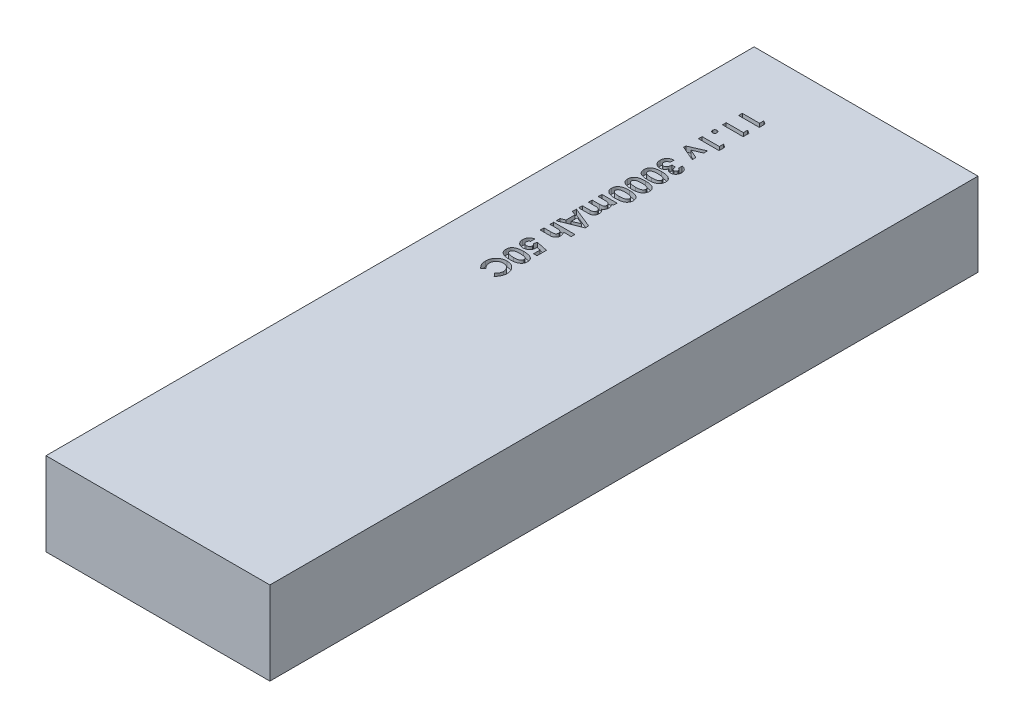
from build123d import *

# Parameters (mm, degrees)
SKETCH1_W           = 43
SKETCH1_H           = 136
BOSS_EXTRUDE1_DEPTH = 16
CUT_EXTRUDE3_DEPTH  = 1


with BuildPart() as part:
    # Sketch1 → Boss-Extrude1 (new body)
    with BuildSketch(Plane(origin=(0, 0, 0), x_dir=(1, 0, 0), z_dir=(0, 1, 0))):
        Rectangle(SKETCH1_W, SKETCH1_H)
    extrude(amount=BOSS_EXTRUDE1_DEPTH)

    # Sketch6 → Cut-Extrude3 (cut)
    # profile 1 of 15: a face of its own
    with BuildSketch(Plane(origin=(0, 16, 0), x_dir=(1, 0, 0), z_dir=(0, 1, 0))):
        Polygon((-7.606060002, 56.204884521), (-7.606060002, 55.103779002), (-11.574810002, 55.103779002), (-11.574810002, 55.816118746), (-8.267518335, 55.816118746), (-8.267518335, 56.63022131), align=None)
    # profile 2 of 15: a face of its own
    with BuildSketch(Plane(origin=(0, 16, 0), x_dir=(1, 0, 0), z_dir=(0, 1, 0))):
        Polygon((-7.606060002, 53.101118496), (-7.606060002, 52.000012977), (-11.574810002, 52.000012977), (-11.574810002, 52.71235272), (-8.267518335, 52.71235272), (-8.267518335, 53.526455285), align=None)
    # profile 3 of 15: a face of its own
    with BuildSketch(Plane(origin=(0, 16, 0), x_dir=(1, 0, 0), z_dir=(0, 1, 0))):
        with BuildLine():
            add(Edge.make_bspline(
                [(-10.760707437, 50.142841502), (-10.762271873, 50.114078339), (-10.765351977, 50.057448638), (-10.788757525, 49.97551841), (-10.829901512, 49.901145037), (-10.884528851, 49.83511534), (-10.949541031, 49.779050333), (-11.024498867, 49.739845227), (-11.105715388, 49.714485392), (-11.162530434, 49.711749694), (-11.191609381, 49.710349515)],
                knots=[0, 0, 0, 0, 1.016476041, 2.001265769, 2.982571086, 4.001334304, 5.018889842, 5.99575474, 6.974191785, 8, 8, 8, 8], degree=3))
            add(Edge.make_bspline(
                [(-11.191609381, 49.710349515), (-11.220692814, 49.711740517), (-11.277516627, 49.714458285), (-11.358895197, 49.740018581), (-11.434461218, 49.778987877), (-11.500174694, 49.835120021), (-11.555827131, 49.900870252), (-11.596582338, 49.975689104), (-11.621304585, 50.057292884), (-11.624215068, 50.114050943), (-11.625691412, 50.142841502)],
                knots=[0, 0, 0, 0, 1.022731703, 1.998234309, 2.980426153, 4.002090265, 5.023754376, 6.00211665, 6.986572482, 8, 8, 8, 8], degree=3))
            add(Edge.make_bspline(
                [(-11.625691412, 50.142841502), (-11.624202964, 50.171625242), (-11.62126862, 50.228369855), (-11.59678868, 50.309846984), (-11.555551818, 50.384117514), (-11.500241785, 50.449851228), (-11.434227456, 50.505733714), (-11.359132136, 50.545843365), (-11.277485846, 50.571167772), (-11.220682393, 50.573923208), (-11.191609381, 50.57533349)],
                knots=[0, 0, 0, 0, 1.013910294, 1.9988351, 2.969460266, 3.991611077, 5.013761889, 6.000813773, 6.976781088, 8, 8, 8, 8], degree=3))
            add(Edge.make_bspline(
                [(-11.191609381, 50.57533349), (-11.162541036, 50.573913909), (-11.105746705, 50.571140302), (-11.024259199, 50.546017214), (-10.949776063, 50.505673428), (-10.884461621, 50.449855707), (-10.830174676, 50.383844137), (-10.788554011, 50.310016726), (-10.765388208, 50.228214023), (-10.762284077, 50.171597813), (-10.760707437, 50.142841502)],
                knots=[0, 0, 0, 0, 1.02629359, 2.005193596, 2.986963232, 4.00500024, 5.0242455, 5.997787305, 6.983042999, 8, 8, 8, 8], degree=3))
        make_face()
    # profile 4 of 15: a face of its own
    with BuildSketch(Plane(origin=(0, 16, 0), x_dir=(1, 0, 0), z_dir=(0, 1, 0))):
        Polygon((-7.606060002, 48.470910162), (-7.606060002, 47.369804643), (-11.574810002, 47.369804643), (-11.574810002, 48.082144387), (-8.267518335, 48.082144387), (-8.267518335, 48.896246951), align=None)
    # profile 5 of 15: a face of its own
    with BuildSketch(Plane(origin=(0, 16, 0), x_dir=(1, 0, 0), z_dir=(0, 1, 0))):
        Polygon((-8.674569617, 46.224972913), (-8.674569617, 45.499912817), (-10.386252059, 44.749412015), (-8.674569617, 43.998911214), (-8.674569617, 43.273851118), (-11.574810002, 44.54429633), (-11.574810002, 44.9545277), align=None)
    # profile 6 of 15: a face of its own
    with BuildSketch(Plane(origin=(0, 16, 0), x_dir=(1, 0, 0), z_dir=(0, 1, 0))):
        with BuildLine():
            Line((-8.572806796, 40.551695669), (-8.572806796, 41.264035413))
            add(Edge.make_bspline(
                [(-8.572806796, 41.264035413), (-8.537199474, 41.259006023), (-8.467393677, 41.249146238), (-8.366332272, 41.225553091), (-8.270468613, 41.197333142), (-8.180106281, 41.162101977), (-8.09508431, 41.120781552), (-8.015110947, 41.073792049), (-7.940529451, 41.020625495), (-7.895601263, 40.979872768), (-7.873187405, 40.959541973)],
                knots=[0, 0, 0, 0, 1.111473889, 2.178970933, 3.205615836, 4.199322666, 5.174200091, 6.12565194, 7.064921805, 8, 8, 8, 8], degree=3))
            add(Edge.make_bspline(
                [(-7.873187405, 40.959541973), (-7.843613945, 40.930217495), (-7.785327763, 40.872422031), (-7.710669601, 40.775839032), (-7.646058039, 40.674602213), (-7.594833526, 40.566681224), (-7.553373217, 40.453755397), (-7.525524234, 40.334926708), (-7.507046187, 40.210680733), (-7.505226035, 40.125898486), (-7.504297181, 40.082632668)],
                knots=[0, 0, 0, 0, 1.01925491, 2.00884431, 2.983262333, 3.955970413, 4.92937149, 5.924503185, 6.940838805, 8, 8, 8, 8], degree=3))
            add(Edge.make_bspline(
                [(-7.504297181, 40.082632668), (-7.505205277, 40.04416713), (-7.506990411, 39.968551634), (-7.521320495, 39.85741588), (-7.546453868, 39.751457239), (-7.579315189, 39.649555698), (-7.624028508, 39.553209896), (-7.675931155, 39.460293387), (-7.739591907, 39.373402263), (-7.811522152, 39.292333214), (-7.889321752, 39.217855831), (-7.972483127, 39.153358091), (-8.058784844, 39.097908226), (-8.148943907, 39.052224872), (-8.243112877, 39.017100581), (-8.340747752, 38.992723281), (-8.441633092, 38.976767746), (-8.5102035, 38.975178158), (-8.544981025, 38.974371951)],
                knots=[0, 0, 0, 0, 1.091422571, 2.145516843, 3.172569842, 4.178562979, 5.178154469, 6.181868002, 7.194278174, 8.227918432, 9.254613415, 10.245994977, 11.209837596, 12.161663635, 13.10878368, 14.055455738, 15.013766427, 16, 16, 16, 16], degree=3))
            add(Edge.make_bspline(
                [(-8.544981025, 38.974371951), (-8.588050095, 38.976026336), (-8.672839851, 38.979283311), (-8.796935959, 39.006009152), (-8.915593984, 39.04784236), (-9.027153722, 39.108274499), (-9.13131157, 39.183830063), (-9.224585218, 39.27653421), (-9.308437071, 39.383746486), (-9.353499067, 39.464232169), (-9.376574074, 39.505446671)],
                knots=[0, 0, 0, 0, 0.992805628, 1.954529043, 2.915727527, 3.886831945, 4.871318353, 5.87440735, 6.911542536, 8, 8, 8, 8], degree=3))
            add(Edge.make_bspline(
                [(-9.376574074, 39.505446671), (-9.385861949, 39.477157669), (-9.404112207, 39.421571049), (-9.440055883, 39.342561352), (-9.479336363, 39.267432159), (-9.524969926, 39.197477167), (-9.575111353, 39.132000589), (-9.630189272, 39.071401578), (-9.690083586, 39.015318069), (-9.755123691, 38.964665603), (-9.824269398, 38.91970956), (-9.895923483, 38.879372897), (-9.97117259, 38.846173574), (-10.049157327, 38.818049615), (-10.130578577, 38.796637633), (-10.215120841, 38.781561685), (-10.302591272, 38.772847417), (-10.361852436, 38.771518343), (-10.391817213, 38.77084631)],
                knots=[0, 0, 0, 0, 1.059543567, 2.081955587, 3.086750234, 4.076226789, 5.052108497, 6.020845489, 6.989030705, 7.970690546, 8.952259656, 9.923888338, 10.895517021, 11.877585046, 12.873342345, 13.889638361, 14.932918083, 16, 16, 16, 16], degree=3))
            add(Edge.make_bspline(
                [(-10.391817213, 38.77084631), (-10.435872626, 38.772091927), (-10.522777843, 38.774549073), (-10.650363737, 38.793304719), (-10.772659439, 38.823430611), (-10.88982345, 38.865752495), (-11.001487706, 38.921180441), (-11.108464518, 38.988069093), (-11.209830417, 39.06761927), (-11.305412197, 39.157525557), (-11.392701931, 39.257049934), (-11.46830467, 39.365068757), (-11.53320461, 39.479067088), (-11.585887289, 39.599803401), (-11.62646026, 39.727225814), (-11.655787937, 39.861053001), (-11.673731178, 40.001846529), (-11.675612181, 40.097949156), (-11.676572822, 40.147029453)],
                knots=[0, 0, 0, 0, 1.00521177, 1.982915163, 2.936446867, 3.875909237, 4.819955514, 5.776532521, 6.750505675, 7.756026749, 8.767695971, 9.766152086, 10.760201606, 11.756952477, 12.766920653, 13.807416198, 14.880231815, 16, 16, 16, 16], degree=3))
            add(Edge.make_bspline(
                [(-11.676572822, 40.147029453), (-11.675560247, 40.193458772), (-11.673580292, 40.284245161), (-11.656434694, 40.417036693), (-11.628796575, 40.543252192), (-11.58977207, 40.663168496), (-11.539493256, 40.776275069), (-11.478805891, 40.88323087), (-11.405850509, 40.982868272), (-11.322348394, 41.075645992), (-11.229954333, 41.160777483), (-11.127915214, 41.234972905), (-11.01846068, 41.29954248), (-10.901355346, 41.354912355), (-10.775554316, 41.398174036), (-10.642181043, 41.432578905), (-10.500658812, 41.45653158), (-10.403296878, 41.463836556), (-10.353656155, 41.467561054)],
                knots=[0, 0, 0, 0, 1.066693477, 2.085777942, 3.071407889, 4.032495163, 4.978645371, 5.911608997, 6.853298848, 7.810770565, 8.776420673, 9.735131334, 10.704462168, 11.693492242, 12.70668109, 13.756973703, 14.856375978, 16, 16, 16, 16], degree=3))
            Line((-10.353656155, 41.467561054), (-10.353656155, 40.75522131))
            add(Edge.make_bspline(
                [(-10.353656155, 40.75522131), (-10.378616524, 40.750707287), (-10.427233388, 40.741915045), (-10.497619799, 40.724766314), (-10.562590804, 40.702419125), (-10.622723863, 40.676580215), (-10.678808502, 40.648670303), (-10.728773378, 40.614948454), (-10.77397524, 40.577885629), (-10.827711713, 40.524403702), (-10.882923695, 40.447947605), (-10.930905534, 40.344706543), (-10.959028786, 40.229860639), (-10.962459737, 40.149571898), (-10.964233078, 40.108073373)],
                knots=[0, 0, 0, 0, 0.928156231, 1.807827665, 2.648129825, 3.438902246, 4.202261636, 4.936546065, 5.639352463, 6.338805438, 7.70633318, 9.064371875, 10.482673459, 12, 12, 12, 12], degree=3))
            add(Edge.make_bspline(
                [(-10.964233078, 40.108073373), (-10.963856233, 40.086052469), (-10.963118077, 40.042918444), (-10.95490898, 39.979566426), (-10.941446269, 39.919193899), (-10.922879413, 39.861552703), (-10.900278724, 39.806173789), (-10.870392479, 39.754619651), (-10.835873857, 39.705831964), (-10.797471415, 39.659901644), (-10.754318952, 39.618627868), (-10.708687198, 39.582217191), (-10.660291428, 39.551273656), (-10.609238144, 39.527214937), (-10.556677478, 39.506447968), (-10.501184237, 39.493662156), (-10.443829016, 39.484031643), (-10.404581129, 39.483470729), (-10.384662015, 39.483186054)],
                knots=[0, 0, 0, 0, 1.110156356, 2.174547939, 3.215517325, 4.225827361, 5.226274409, 6.226006852, 7.223592408, 8.238489974, 9.24054302, 10.230036266, 11.179350721, 12.129887733, 13.073255049, 14.023133956, 14.996699621, 16, 16, 16, 16], degree=3))
            add(Edge.make_bspline(
                [(-10.384662015, 39.483186054), (-10.362876744, 39.483940651), (-10.319507262, 39.485442882), (-10.256218623, 39.497716266), (-10.195340052, 39.517098533), (-10.137141149, 39.54402287), (-10.081836425, 39.57997732), (-10.028316297, 39.622403171), (-9.979366394, 39.674642877), (-9.930980898, 39.731956831), (-9.888803339, 39.798418502), (-9.849879649, 39.870791113), (-9.818908409, 39.950976729), (-9.791245355, 40.037017946), (-9.77104069, 40.130542317), (-9.756370133, 40.230969087), (-9.745450178, 40.338136256), (-9.743883531, 40.412007978), (-9.743079232, 40.449932849)],
                knots=[0, 0, 0, 0, 0.809814727, 1.612155564, 2.388397, 3.182215007, 3.988903953, 4.837162975, 5.715530372, 6.646997145, 7.623086902, 8.637258368, 9.698941581, 10.815059213, 11.996518529, 13.252603015, 14.589518788, 16, 16, 16, 16], degree=3))
            Line((-9.743079232, 40.449932849), (-9.081620899, 40.449932849))
            add(Edge.make_bspline(
                [(-9.081620899, 40.449932849), (-9.077596013, 40.402715078), (-9.070066247, 40.31437998), (-9.052516564, 40.191752231), (-9.028815197, 40.088314655), (-9.000717082, 40.001663476), (-8.96443847, 39.929817172), (-8.923422817, 39.867784221), (-8.877500059, 39.813267771), (-8.825622869, 39.767541367), (-8.76953694, 39.732087002), (-8.711201119, 39.706120046), (-8.651412097, 39.689137061), (-8.610546317, 39.687515286), (-8.590297281, 39.686711695)],
                knots=[0, 0, 0, 0, 1.700000582, 3.18036443, 4.43953496, 5.503843555, 6.439238578, 7.317314143, 8.167035247, 8.988963526, 9.788142765, 10.537231438, 11.275196671, 12, 12, 12, 12], degree=3))
            add(Edge.make_bspline(
                [(-8.590297281, 39.686711695), (-8.564447689, 39.688071881), (-8.513994757, 39.690726678), (-8.44209716, 39.711890838), (-8.37727404, 39.747071668), (-8.32120516, 39.796002713), (-8.273800305, 39.85538162), (-8.240076418, 39.925445991), (-8.219757418, 40.003847677), (-8.217700647, 40.058920312), (-8.216636925, 40.087402801)],
                knots=[0, 0, 0, 0, 1.009121812, 1.969592135, 2.901310697, 3.870954244, 4.859448864, 5.850870115, 6.888512099, 8, 8, 8, 8], degree=3))
            add(Edge.make_bspline(
                [(-8.216636925, 40.087402801), (-8.217904524, 40.113214662), (-8.220419828, 40.164433302), (-8.239276949, 40.23930005), (-8.270699674, 40.310316618), (-8.3148261, 40.375661727), (-8.367275707, 40.435174668), (-8.428891425, 40.485075059), (-8.497263239, 40.525697065), (-8.547526894, 40.542995494), (-8.572806796, 40.551695669)],
                knots=[0, 0, 0, 0, 0.988439209, 1.961366134, 2.938893463, 3.950078543, 4.971412263, 5.967491143, 6.977757845, 8, 8, 8, 8], degree=3))
        make_face()
    # profile 7 of 15: a face of its own
    with BuildSketch(Plane(origin=(0, 16, 0), x_dir=(1, 0, 0), z_dir=(0, 1, 0))):
        with BuildLine():
            add(Edge.make_bspline(
                [(-7.504297181, 37.027362987), (-7.504808984, 36.992882751), (-7.505815325, 36.925085396), (-7.516717146, 36.825233261), (-7.533181936, 36.729045711), (-7.556161655, 36.636157341), (-7.586513163, 36.547197195), (-7.623154098, 36.461447968), (-7.666960518, 36.37963079), (-7.717297035, 36.301556399), (-7.77359259, 36.22686118), (-7.838665114, 36.158030093), (-7.909632164, 36.092398932), (-7.987665172, 36.031055963), (-8.073296017, 35.974687983), (-8.165390295, 35.922242763), (-8.264814875, 35.874396612), (-8.371671089, 35.830516572), (-8.487578531, 35.791261629), (-8.613879654, 35.758290594), (-8.750483925, 35.729626535), (-8.898103005, 35.707052782), (-9.056388678, 35.6885767), (-9.225637133, 35.676504632), (-9.405374734, 35.66810647), (-9.52867768, 35.667428562), (-9.592025046, 35.667080285)],
                knots=[0, 0, 0, 0, 0.879087513, 1.728520926, 2.558587148, 3.366762743, 4.166157112, 4.95337177, 5.74258602, 6.530032775, 7.320866164, 8.124307838, 8.942260106, 9.784645725, 10.652593514, 11.554662219, 12.485739241, 13.464770064, 14.499274465, 15.604285219, 16.792026686, 18.057713884, 19.411711354, 20.855437135, 22.384468668, 24, 24, 24, 24], degree=3))
            add(Edge.make_bspline(
                [(-9.592025046, 35.667080285), (-9.656164565, 35.667459316), (-9.780786499, 35.668195767), (-9.96217346, 35.676130565), (-10.132632036, 35.689794552), (-10.292144355, 35.707406024), (-10.440626982, 35.731527761), (-10.578461678, 35.759781433), (-10.705607633, 35.793343186), (-10.82174757, 35.833904665), (-10.928857149, 35.877410234), (-11.027741439, 35.92572419), (-11.120176937, 35.975939374), (-11.204875473, 36.031099772), (-11.282023251, 36.090033081), (-11.352329032, 36.151814106), (-11.414824743, 36.217759317), (-11.470800966, 36.286882502), (-11.519798598, 36.360863323), (-11.561894262, 36.439376362), (-11.596682373, 36.5229514), (-11.626667579, 36.610372625), (-11.648240482, 36.703195246), (-11.665343776, 36.79998605), (-11.674799167, 36.90182604), (-11.675971901, 36.971163264), (-11.676572822, 37.006692414)],
                knots=[0, 0, 0, 0, 1.643682949, 3.193646483, 4.651618242, 6.025629174, 7.305184366, 8.505292942, 9.630500342, 10.672179876, 11.655924581, 12.591484594, 13.491256898, 14.350247848, 15.17884557, 15.977481787, 16.746098769, 17.504475725, 18.254166354, 19.016819136, 19.783753977, 20.571954997, 21.382401421, 22.223156612, 23.089526058, 24, 24, 24, 24], degree=3))
            add(Edge.make_bspline(
                [(-11.676572822, 37.006692414), (-11.675957723, 37.042219906), (-11.674752752, 37.111817742), (-11.665442757, 37.213942935), (-11.648023778, 37.311465247), (-11.626804477, 37.405151715), (-11.596520687, 37.494179565), (-11.56117416, 37.579199195), (-11.518838064, 37.65978734), (-11.470057819, 37.735994766), (-11.414108595, 37.807545511), (-11.351602149, 37.875555692), (-11.282693294, 37.939873716), (-11.206611201, 37.999521495), (-11.124371106, 38.055475657), (-11.035034033, 38.107153277), (-10.938729691, 38.154521052), (-10.835325203, 38.199069609), (-10.722588883, 38.237748435), (-10.599536668, 38.272288144), (-10.465007106, 38.300107813), (-10.319505702, 38.324475391), (-10.162522559, 38.340836682), (-9.994781822, 38.35482966), (-9.815765869, 38.362658841), (-9.692734792, 38.363408869), (-9.629391081, 38.363795028)],
                knots=[0, 0, 0, 0, 0.917197984, 1.796777363, 2.643741708, 3.473481078, 4.273990801, 5.068160217, 5.848535553, 6.620952589, 7.401027954, 8.190319769, 9.003592045, 9.831693788, 10.683727512, 11.569696396, 12.49373307, 13.453184301, 14.474457586, 15.568383184, 16.750575061, 18.019320986, 19.375517054, 20.823796471, 22.364701649, 24, 24, 24, 24], degree=3))
            add(Edge.make_bspline(
                [(-9.629391081, 38.363795028), (-9.541380221, 38.363103946), (-9.371562131, 38.361770493), (-9.126189761, 38.345305261), (-8.899553594, 38.320397843), (-8.691379791, 38.286301503), (-8.502075815, 38.240377447), (-8.331696041, 38.184018687), (-8.178553928, 38.119350786), (-8.087816923, 38.064333045), (-8.044117143, 38.037835994)],
                knots=[0, 0, 0, 0, 1.288526675, 2.486228817, 3.599112392, 4.626206381, 5.5730174, 6.447949553, 7.252518174, 8, 8, 8, 8], degree=3))
            add(Edge.make_bspline(
                [(-8.044117143, 38.037835994), (-8.001187683, 38.007020326), (-7.917252129, 37.946769623), (-7.807060437, 37.841419586), (-7.712819105, 37.728234687), (-7.636660901, 37.604890173), (-7.576602535, 37.473336789), (-7.534183987, 37.332445083), (-7.509468965, 37.182735344), (-7.506046852, 37.079927169), (-7.504297181, 37.027362987)],
                knots=[0, 0, 0, 0, 1.058512271, 2.069600068, 3.047294572, 4.004278952, 4.967380941, 5.939006123, 6.946246673, 8, 8, 8, 8], degree=3))
        make_face()
        with BuildLine():
            add(Edge.make_bspline(
                [(-8.216636925, 37.009872502), (-8.218125665, 37.041037146), (-8.221044386, 37.102136391), (-8.245405128, 37.190659406), (-8.283850166, 37.273758941), (-8.329165768, 37.337371047), (-8.373376563, 37.384769443), (-8.412157605, 37.419122043), (-8.45751512, 37.449888303), (-8.507488557, 37.479573512), (-8.563453221, 37.505985391), (-8.623997546, 37.532248003), (-8.691142816, 37.55364447), (-8.763623581, 37.574716721), (-8.843483245, 37.593139304), (-8.931349856, 37.608690141), (-9.027884124, 37.622100002), (-9.132852042, 37.633423048), (-9.246671531, 37.640621996), (-9.369077592, 37.647588725), (-9.500323544, 37.650124876), (-9.590700371, 37.651002412), (-9.637341302, 37.651455285)],
                knots=[0, 0, 0, 0, 1.076821401, 2.111141558, 3.153197101, 4.23200803, 4.796476379, 5.394298193, 6.020090776, 6.690078086, 7.403703365, 8.159894791, 8.971856079, 9.83973388, 10.771758647, 11.806038152, 12.926526118, 14.143777411, 15.458313878, 16.872423957, 18.385946227, 20, 20, 20, 20], degree=3))
            add(Edge.make_bspline(
                [(-9.637341302, 37.651455285), (-9.697768452, 37.650729938), (-9.813641993, 37.649339033), (-9.980266091, 37.642026121), (-10.131928747, 37.627452512), (-10.269565037, 37.609089493), (-10.392652709, 37.584074252), (-10.501229973, 37.55292668), (-10.596100687, 37.5183859), (-10.675869674, 37.475078304), (-10.74408853, 37.428678008), (-10.803101252, 37.379153007), (-10.852259566, 37.325639534), (-10.893993995, 37.269737134), (-10.924984249, 37.209372707), (-10.947577143, 37.145784046), (-10.961352565, 37.078829995), (-10.963267357, 37.032991209), (-10.964233078, 37.009872502)],
                knots=[0, 0, 0, 0, 1.772047989, 3.398033405, 4.888860297, 6.238411839, 7.468309579, 8.567754056, 9.549141588, 10.421774021, 11.221426488, 11.965694757, 12.675067502, 13.348095901, 14.005005053, 14.656328889, 15.322321954, 16, 16, 16, 16], degree=3))
            add(Edge.make_bspline(
                [(-10.964233078, 37.009872502), (-10.963573043, 36.987546295), (-10.962280777, 36.943834358), (-10.949015836, 36.880092564), (-10.927449923, 36.819813795), (-10.896943425, 36.76318005), (-10.858149745, 36.709988759), (-10.810898407, 36.660499887), (-10.754718426, 36.615086671), (-10.713024571, 36.588628725), (-10.69154052, 36.574995449)],
                knots=[0, 0, 0, 0, 0.992283464, 1.942767638, 2.88273346, 3.832339453, 4.79467288, 5.803907806, 6.868395428, 8, 8, 8, 8], degree=3))
            add(Edge.make_bspline(
                [(-10.69154052, 36.574995449), (-10.662184233, 36.558939605), (-10.600626478, 36.525271803), (-10.496729408, 36.486410167), (-10.379698268, 36.453258215), (-10.248586792, 36.426682709), (-10.10392106, 36.405633124), (-9.945593553, 36.389540712), (-9.773377325, 36.381366835), (-9.6540441, 36.380085799), (-9.592025046, 36.379420028)],
                knots=[0, 0, 0, 0, 0.710996797, 1.490902623, 2.352723643, 3.296875318, 4.334065587, 5.461510359, 6.680713396, 8, 8, 8, 8], degree=3))
            add(Edge.make_bspline(
                [(-9.592025046, 36.379420028), (-9.529469561, 36.37968179), (-9.409060931, 36.380185638), (-9.236200185, 36.389429799), (-9.078320558, 36.402302979), (-8.935774636, 36.42113279), (-8.808216043, 36.445360567), (-8.695654189, 36.475222012), (-8.597863856, 36.510424511), (-8.514953174, 36.552176532), (-8.444465523, 36.598400422), (-8.384076109, 36.647531441), (-8.332085534, 36.699654549), (-8.289944965, 36.755331348), (-8.256357858, 36.814190281), (-8.233468956, 36.876548915), (-8.219388472, 36.94219981), (-8.217566487, 36.987010468), (-8.216636925, 37.009872502)],
                knots=[0, 0, 0, 0, 1.793903324, 3.452957663, 4.963427329, 6.336122014, 7.574844885, 8.684777121, 9.673127442, 10.55010789, 11.340650774, 12.086136756, 12.779466299, 13.446812155, 14.083183996, 14.715685896, 15.34475337, 16, 16, 16, 16], degree=3))
        make_face(mode=Mode.SUBTRACT)
    # profile 8 of 15: a face of its own
    with BuildSketch(Plane(origin=(0, 16, 0), x_dir=(1, 0, 0), z_dir=(0, 1, 0))):
        with BuildLine():
            add(Edge.make_bspline(
                [(-7.504297181, 33.923596961), (-7.504808984, 33.889116726), (-7.505815325, 33.82131937), (-7.516717146, 33.721467235), (-7.533181936, 33.625279686), (-7.556161655, 33.532391315), (-7.586513163, 33.443431169), (-7.623154098, 33.357681943), (-7.666960518, 33.275864764), (-7.717297035, 33.197790373), (-7.77359259, 33.123095154), (-7.838665114, 33.054264068), (-7.909632164, 32.988632906), (-7.987665172, 32.927289937), (-8.073296017, 32.870921957), (-8.165390295, 32.818476737), (-8.264814875, 32.770630586), (-8.371671089, 32.726750546), (-8.487578531, 32.687495604), (-8.613879654, 32.654524569), (-8.750483925, 32.625860509), (-8.898103005, 32.603286757), (-9.056388678, 32.584810674), (-9.225637133, 32.572738607), (-9.405374734, 32.564340445), (-9.52867768, 32.563662537), (-9.592025046, 32.563314259)],
                knots=[0, 0, 0, 0, 0.879087513, 1.728520926, 2.558587148, 3.366762743, 4.166157112, 4.95337177, 5.74258602, 6.530032775, 7.320866164, 8.124307838, 8.942260106, 9.784645725, 10.652593514, 11.554662219, 12.485739241, 13.464770064, 14.499274465, 15.604285219, 16.792026686, 18.057713884, 19.411711354, 20.855437135, 22.384468668, 24, 24, 24, 24], degree=3))
            add(Edge.make_bspline(
                [(-9.592025046, 32.563314259), (-9.656164565, 32.56369329), (-9.780786499, 32.564429742), (-9.96217346, 32.572364539), (-10.132632036, 32.586028527), (-10.292144355, 32.603639998), (-10.440626982, 32.627761735), (-10.578461678, 32.656015407), (-10.705607633, 32.68957716), (-10.82174757, 32.730138639), (-10.928857149, 32.773644208), (-11.027741439, 32.821958164), (-11.120176937, 32.872173348), (-11.204875473, 32.927333747), (-11.282023251, 32.986267056), (-11.352329032, 33.04804808), (-11.414824743, 33.113993292), (-11.470800966, 33.183116476), (-11.519798598, 33.257097297), (-11.561894262, 33.335610337), (-11.596682373, 33.419185374), (-11.626667579, 33.506606599), (-11.648240482, 33.59942922), (-11.665343776, 33.696220025), (-11.674799167, 33.798060014), (-11.675971901, 33.867397238), (-11.676572822, 33.902926388)],
                knots=[0, 0, 0, 0, 1.643682949, 3.193646483, 4.651618242, 6.025629174, 7.305184366, 8.505292942, 9.630500342, 10.672179876, 11.655924581, 12.591484594, 13.491256898, 14.350247848, 15.17884557, 15.977481787, 16.746098769, 17.504475725, 18.254166354, 19.016819136, 19.783753977, 20.571954997, 21.382401421, 22.223156612, 23.089526058, 24, 24, 24, 24], degree=3))
            add(Edge.make_bspline(
                [(-11.676572822, 33.902926388), (-11.675957723, 33.938453881), (-11.674752752, 34.008051716), (-11.665442757, 34.110176909), (-11.648023778, 34.207699221), (-11.626804477, 34.301385689), (-11.596520687, 34.390413539), (-11.56117416, 34.47543317), (-11.518838064, 34.556021314), (-11.470057819, 34.63222874), (-11.414108595, 34.703779485), (-11.351602149, 34.771789666), (-11.282693294, 34.83610769), (-11.206611201, 34.895755469), (-11.124371106, 34.951709632), (-11.035034033, 35.003387251), (-10.938729691, 35.050755026), (-10.835325203, 35.095303584), (-10.722588883, 35.133982409), (-10.599536668, 35.168522119), (-10.465007106, 35.196341787), (-10.319505702, 35.220709366), (-10.162522559, 35.237070656), (-9.994781822, 35.251063634), (-9.815765869, 35.258892816), (-9.692734792, 35.259642844), (-9.629391081, 35.260029002)],
                knots=[0, 0, 0, 0, 0.917197984, 1.796777363, 2.643741708, 3.473481078, 4.273990801, 5.068160217, 5.848535553, 6.620952589, 7.401027954, 8.190319769, 9.003592045, 9.831693788, 10.683727512, 11.569696396, 12.49373307, 13.453184301, 14.474457586, 15.568383184, 16.750575061, 18.019320986, 19.375517054, 20.823796471, 22.364701649, 24, 24, 24, 24], degree=3))
            add(Edge.make_bspline(
                [(-9.629391081, 35.260029002), (-9.541380221, 35.25933792), (-9.371562131, 35.258004468), (-9.126189761, 35.241539235), (-8.899553594, 35.216631818), (-8.691379791, 35.182535477), (-8.502075815, 35.136611422), (-8.331696041, 35.080252661), (-8.178553928, 35.01558476), (-8.087816923, 34.96056702), (-8.044117143, 34.934069968)],
                knots=[0, 0, 0, 0, 1.288526675, 2.486228817, 3.599112392, 4.626206381, 5.5730174, 6.447949553, 7.252518174, 8, 8, 8, 8], degree=3))
            add(Edge.make_bspline(
                [(-8.044117143, 34.934069968), (-8.001187683, 34.9032543), (-7.917252129, 34.843003598), (-7.807060437, 34.73765356), (-7.712819105, 34.624468661), (-7.636660901, 34.501124147), (-7.576602535, 34.369570764), (-7.534183987, 34.228679057), (-7.509468965, 34.078969318), (-7.506046852, 33.976161143), (-7.504297181, 33.923596961)],
                knots=[0, 0, 0, 0, 1.058512271, 2.069600068, 3.047294572, 4.004278952, 4.967380941, 5.939006123, 6.946246673, 8, 8, 8, 8], degree=3))
        make_face()
        with BuildLine():
            add(Edge.make_bspline(
                [(-8.216636925, 33.906106476), (-8.218125665, 33.93727112), (-8.221044386, 33.998370365), (-8.245405128, 34.086893381), (-8.283850166, 34.169992915), (-8.329165768, 34.233605022), (-8.373376563, 34.281003417), (-8.412157605, 34.315356017), (-8.45751512, 34.346122278), (-8.507488557, 34.375807486), (-8.563453221, 34.402219365), (-8.623997546, 34.428481977), (-8.691142816, 34.449878444), (-8.763623581, 34.470950696), (-8.843483245, 34.489373279), (-8.931349856, 34.504924115), (-9.027884124, 34.518333977), (-9.132852042, 34.529657022), (-9.246671531, 34.536855971), (-9.369077592, 34.5438227), (-9.500323544, 34.54635885), (-9.590700371, 34.547236387), (-9.637341302, 34.547689259)],
                knots=[0, 0, 0, 0, 1.076821401, 2.111141558, 3.153197101, 4.23200803, 4.796476379, 5.394298193, 6.020090776, 6.690078086, 7.403703365, 8.159894791, 8.971856079, 9.83973388, 10.771758647, 11.806038152, 12.926526118, 14.143777411, 15.458313878, 16.872423957, 18.385946227, 20, 20, 20, 20], degree=3))
            add(Edge.make_bspline(
                [(-9.637341302, 34.547689259), (-9.697768452, 34.546963913), (-9.813641993, 34.545573008), (-9.980266091, 34.538260095), (-10.131928747, 34.523686486), (-10.269565037, 34.505323467), (-10.392652709, 34.480308227), (-10.501229973, 34.449160654), (-10.596100687, 34.414619875), (-10.675869674, 34.371312278), (-10.74408853, 34.324911983), (-10.803101252, 34.275386981), (-10.852259566, 34.221873508), (-10.893993995, 34.165971108), (-10.924984249, 34.105606681), (-10.947577143, 34.042018021), (-10.961352565, 33.975063969), (-10.963267357, 33.929225183), (-10.964233078, 33.906106476)],
                knots=[0, 0, 0, 0, 1.772047989, 3.398033405, 4.888860297, 6.238411839, 7.468309579, 8.567754056, 9.549141588, 10.421774021, 11.221426488, 11.965694757, 12.675067502, 13.348095901, 14.005005053, 14.656328889, 15.322321954, 16, 16, 16, 16], degree=3))
            add(Edge.make_bspline(
                [(-10.964233078, 33.906106476), (-10.963573043, 33.883780269), (-10.962280777, 33.840068332), (-10.949015836, 33.776326539), (-10.927449923, 33.716047769), (-10.896943425, 33.659414024), (-10.858149745, 33.606222733), (-10.810898407, 33.556733862), (-10.754718426, 33.511320646), (-10.713024571, 33.4848627), (-10.69154052, 33.471229423)],
                knots=[0, 0, 0, 0, 0.992283464, 1.942767638, 2.88273346, 3.832339453, 4.79467288, 5.803907806, 6.868395428, 8, 8, 8, 8], degree=3))
            add(Edge.make_bspline(
                [(-10.69154052, 33.471229423), (-10.662184233, 33.455173579), (-10.600626478, 33.421505777), (-10.496729408, 33.382644142), (-10.379698268, 33.349492189), (-10.248586792, 33.322916683), (-10.10392106, 33.301867098), (-9.945593553, 33.285774687), (-9.773377325, 33.277600809), (-9.6540441, 33.276319774), (-9.592025046, 33.275654002)],
                knots=[0, 0, 0, 0, 0.710996797, 1.490902623, 2.352723643, 3.296875318, 4.334065587, 5.461510359, 6.680713396, 8, 8, 8, 8], degree=3))
            add(Edge.make_bspline(
                [(-9.592025046, 33.275654002), (-9.529469561, 33.275915765), (-9.409060931, 33.276419612), (-9.236200185, 33.285663773), (-9.078320558, 33.298536954), (-8.935774636, 33.317366764), (-8.808216043, 33.341594541), (-8.695654189, 33.371455986), (-8.597863856, 33.406658485), (-8.514953174, 33.448410507), (-8.444465523, 33.494634396), (-8.384076109, 33.543765415), (-8.332085534, 33.595888523), (-8.289944965, 33.651565322), (-8.256357858, 33.710424255), (-8.233468956, 33.77278289), (-8.219388472, 33.838433785), (-8.217566487, 33.883244443), (-8.216636925, 33.906106476)],
                knots=[0, 0, 0, 0, 1.793903324, 3.452957663, 4.963427329, 6.336122014, 7.574844885, 8.684777121, 9.673127442, 10.55010789, 11.340650774, 12.086136756, 12.779466299, 13.446812155, 14.083183996, 14.715685896, 15.34475337, 16, 16, 16, 16], degree=3))
        make_face(mode=Mode.SUBTRACT)
    # profile 9 of 15: a face of its own
    with BuildSketch(Plane(origin=(0, 16, 0), x_dir=(1, 0, 0), z_dir=(0, 1, 0))):
        with BuildLine():
            add(Edge.make_bspline(
                [(-7.504297181, 30.819830936), (-7.504808984, 30.7853507), (-7.505815325, 30.717553344), (-7.516717146, 30.61770121), (-7.533181936, 30.52151366), (-7.556161655, 30.42862529), (-7.586513163, 30.339665144), (-7.623154098, 30.253915917), (-7.666960518, 30.172098738), (-7.717297035, 30.094024348), (-7.77359259, 30.019329128), (-7.838665114, 29.950498042), (-7.909632164, 29.884866881), (-7.987665172, 29.823523912), (-8.073296017, 29.767155931), (-8.165390295, 29.714710712), (-8.264814875, 29.66686456), (-8.371671089, 29.622984521), (-8.487578531, 29.583729578), (-8.613879654, 29.550758543), (-8.750483925, 29.522094484), (-8.898103005, 29.499520731), (-9.056388678, 29.481044649), (-9.225637133, 29.468972581), (-9.405374734, 29.460574419), (-9.52867768, 29.459896511), (-9.592025046, 29.459548233)],
                knots=[0, 0, 0, 0, 0.879087513, 1.728520926, 2.558587148, 3.366762743, 4.166157112, 4.95337177, 5.74258602, 6.530032775, 7.320866164, 8.124307838, 8.942260106, 9.784645725, 10.652593514, 11.554662219, 12.485739241, 13.464770064, 14.499274465, 15.604285219, 16.792026686, 18.057713884, 19.411711354, 20.855437135, 22.384468668, 24, 24, 24, 24], degree=3))
            add(Edge.make_bspline(
                [(-9.592025046, 29.459548233), (-9.656164565, 29.459927265), (-9.780786499, 29.460663716), (-9.96217346, 29.468598513), (-10.132632036, 29.482262501), (-10.292144355, 29.499873973), (-10.440626982, 29.523995709), (-10.578461678, 29.552249381), (-10.705607633, 29.585811135), (-10.82174757, 29.626372613), (-10.928857149, 29.669878182), (-11.027741439, 29.718192138), (-11.120176937, 29.768407323), (-11.204875473, 29.823567721), (-11.282023251, 29.88250103), (-11.352329032, 29.944282055), (-11.414824743, 30.010227266), (-11.470800966, 30.07935045), (-11.519798598, 30.153331271), (-11.561894262, 30.231844311), (-11.596682373, 30.315419348), (-11.626667579, 30.402840574), (-11.648240482, 30.495663195), (-11.665343776, 30.592453999), (-11.674799167, 30.694293989), (-11.675971901, 30.763631212), (-11.676572822, 30.799160363)],
                knots=[0, 0, 0, 0, 1.643682949, 3.193646483, 4.651618242, 6.025629174, 7.305184366, 8.505292942, 9.630500342, 10.672179876, 11.655924581, 12.591484594, 13.491256898, 14.350247848, 15.17884557, 15.977481787, 16.746098769, 17.504475725, 18.254166354, 19.016819136, 19.783753977, 20.571954997, 21.382401421, 22.223156612, 23.089526058, 24, 24, 24, 24], degree=3))
            add(Edge.make_bspline(
                [(-11.676572822, 30.799160363), (-11.675957723, 30.834687855), (-11.674752752, 30.904285691), (-11.665442757, 31.006410884), (-11.648023778, 31.103933195), (-11.626804477, 31.197619663), (-11.596520687, 31.286647514), (-11.56117416, 31.371667144), (-11.518838064, 31.452255288), (-11.470057819, 31.528462715), (-11.414108595, 31.600013459), (-11.351602149, 31.668023641), (-11.282693294, 31.732341664), (-11.206611201, 31.791989444), (-11.124371106, 31.847943606), (-11.035034033, 31.899621225), (-10.938729691, 31.946989001), (-10.835325203, 31.991537558), (-10.722588883, 32.030216384), (-10.599536668, 32.064756093), (-10.465007106, 32.092575761), (-10.319505702, 32.11694334), (-10.162522559, 32.133304631), (-9.994781822, 32.147297609), (-9.815765869, 32.15512679), (-9.692734792, 32.155876818), (-9.629391081, 32.156262977)],
                knots=[0, 0, 0, 0, 0.917197984, 1.796777363, 2.643741708, 3.473481078, 4.273990801, 5.068160217, 5.848535553, 6.620952589, 7.401027954, 8.190319769, 9.003592045, 9.831693788, 10.683727512, 11.569696396, 12.49373307, 13.453184301, 14.474457586, 15.568383184, 16.750575061, 18.019320986, 19.375517054, 20.823796471, 22.364701649, 24, 24, 24, 24], degree=3))
            add(Edge.make_bspline(
                [(-9.629391081, 32.156262977), (-9.541380221, 32.155571894), (-9.371562131, 32.154238442), (-9.126189761, 32.137773209), (-8.899553594, 32.112865792), (-8.691379791, 32.078769451), (-8.502075815, 32.032845396), (-8.331696041, 31.976486635), (-8.178553928, 31.911818734), (-8.087816923, 31.856800994), (-8.044117143, 31.830303942)],
                knots=[0, 0, 0, 0, 1.288526675, 2.486228817, 3.599112392, 4.626206381, 5.5730174, 6.447949553, 7.252518174, 8, 8, 8, 8], degree=3))
            add(Edge.make_bspline(
                [(-8.044117143, 31.830303942), (-8.001187683, 31.799488275), (-7.917252129, 31.739237572), (-7.807060437, 31.633887534), (-7.712819105, 31.520702635), (-7.636660901, 31.397358122), (-7.576602535, 31.265804738), (-7.534183987, 31.124913032), (-7.509468965, 30.975203292), (-7.506046852, 30.872395117), (-7.504297181, 30.819830936)],
                knots=[0, 0, 0, 0, 1.058512271, 2.069600068, 3.047294572, 4.004278952, 4.967380941, 5.939006123, 6.946246673, 8, 8, 8, 8], degree=3))
        make_face()
        with BuildLine():
            add(Edge.make_bspline(
                [(-8.216636925, 30.802340451), (-8.218125665, 30.833505095), (-8.221044386, 30.89460434), (-8.245405128, 30.983127355), (-8.283850166, 31.06622689), (-8.329165768, 31.129838996), (-8.373376563, 31.177237391), (-8.412157605, 31.211589992), (-8.45751512, 31.242356252), (-8.507488557, 31.27204146), (-8.563453221, 31.29845334), (-8.623997546, 31.324715951), (-8.691142816, 31.346112419), (-8.763623581, 31.36718467), (-8.843483245, 31.385607253), (-8.931349856, 31.40115809), (-9.027884124, 31.414567951), (-9.132852042, 31.425890996), (-9.246671531, 31.433089945), (-9.369077592, 31.440056674), (-9.500323544, 31.442592824), (-9.590700371, 31.443470361), (-9.637341302, 31.443923233)],
                knots=[0, 0, 0, 0, 1.076821401, 2.111141558, 3.153197101, 4.23200803, 4.796476379, 5.394298193, 6.020090776, 6.690078086, 7.403703365, 8.159894791, 8.971856079, 9.83973388, 10.771758647, 11.806038152, 12.926526118, 14.143777411, 15.458313878, 16.872423957, 18.385946227, 20, 20, 20, 20], degree=3))
            add(Edge.make_bspline(
                [(-9.637341302, 31.443923233), (-9.697768452, 31.443197887), (-9.813641993, 31.441806982), (-9.980266091, 31.43449407), (-10.131928747, 31.419920461), (-10.269565037, 31.401557441), (-10.392652709, 31.376542201), (-10.501229973, 31.345394629), (-10.596100687, 31.310853849), (-10.675869674, 31.267546253), (-10.74408853, 31.221145957), (-10.803101252, 31.171620956), (-10.852259566, 31.118107482), (-10.893993995, 31.062205082), (-10.924984249, 31.001840655), (-10.947577143, 30.938251995), (-10.961352565, 30.871297943), (-10.963267357, 30.825459158), (-10.964233078, 30.802340451)],
                knots=[0, 0, 0, 0, 1.772047989, 3.398033405, 4.888860297, 6.238411839, 7.468309579, 8.567754056, 9.549141588, 10.421774021, 11.221426488, 11.965694757, 12.675067502, 13.348095901, 14.005005053, 14.656328889, 15.322321954, 16, 16, 16, 16], degree=3))
            add(Edge.make_bspline(
                [(-10.964233078, 30.802340451), (-10.963573043, 30.780014244), (-10.962280777, 30.736302307), (-10.949015836, 30.672560513), (-10.927449923, 30.612281743), (-10.896943425, 30.555647998), (-10.858149745, 30.502456707), (-10.810898407, 30.452967836), (-10.754718426, 30.40755462), (-10.713024571, 30.381096674), (-10.69154052, 30.367463397)],
                knots=[0, 0, 0, 0, 0.992283464, 1.942767638, 2.88273346, 3.832339453, 4.79467288, 5.803907806, 6.868395428, 8, 8, 8, 8], degree=3))
            add(Edge.make_bspline(
                [(-10.69154052, 30.367463397), (-10.662184233, 30.351407554), (-10.600626478, 30.317739751), (-10.496729408, 30.278878116), (-10.379698268, 30.245726164), (-10.248586792, 30.219150658), (-10.10392106, 30.198101073), (-9.945593553, 30.182008661), (-9.773377325, 30.173834784), (-9.6540441, 30.172553748), (-9.592025046, 30.171887977)],
                knots=[0, 0, 0, 0, 0.710996797, 1.490902623, 2.352723643, 3.296875318, 4.334065587, 5.461510359, 6.680713396, 8, 8, 8, 8], degree=3))
            add(Edge.make_bspline(
                [(-9.592025046, 30.171887977), (-9.529469561, 30.172149739), (-9.409060931, 30.172653587), (-9.236200185, 30.181897747), (-9.078320558, 30.194770928), (-8.935774636, 30.213600739), (-8.808216043, 30.237828516), (-8.695654189, 30.26768996), (-8.597863856, 30.302892459), (-8.514953174, 30.344644481), (-8.444465523, 30.390868371), (-8.384076109, 30.439999389), (-8.332085534, 30.492122497), (-8.289944965, 30.547799297), (-8.256357858, 30.606658229), (-8.233468956, 30.669016864), (-8.219388472, 30.734667759), (-8.217566487, 30.779478417), (-8.216636925, 30.802340451)],
                knots=[0, 0, 0, 0, 1.793903324, 3.452957663, 4.963427329, 6.336122014, 7.574844885, 8.684777121, 9.673127442, 10.55010789, 11.340650774, 12.086136756, 12.779466299, 13.446812155, 14.083183996, 14.715685896, 15.34475337, 16, 16, 16, 16], degree=3))
        make_face(mode=Mode.SUBTRACT)
    # profile 10 of 15: a face of its own
    with BuildSketch(Plane(origin=(0, 16, 0), x_dir=(1, 0, 0), z_dir=(0, 1, 0))):
        with BuildLine():
            Line((-8.674569617, 28.84897131), (-8.674569617, 28.136631567))
            Line((-8.674569617, 28.136631567), (-9.021199224, 28.136631567))
            add(Edge.make_bspline(
                [(-9.021199224, 28.136631567), (-8.989231235, 28.104940071), (-8.926288891, 28.042542121), (-8.845050891, 27.939082686), (-8.776304871, 27.830669935), (-8.720216572, 27.717160605), (-8.677115321, 27.598442243), (-8.645939772, 27.474638041), (-8.627409616, 27.345084352), (-8.624942427, 27.256867077), (-8.623688207, 27.21202094)],
                knots=[0, 0, 0, 0, 1.041604913, 2.050834463, 3.038316637, 4.009881179, 4.976705026, 5.957567047, 6.961708705, 8, 8, 8, 8], degree=3))
            add(Edge.make_bspline(
                [(-8.623688207, 27.21202094), (-8.625104621, 27.167118509), (-8.627892787, 27.078729527), (-8.653278964, 26.949733297), (-8.694901362, 26.827450196), (-8.753093142, 26.712985899), (-8.826652248, 26.606764809), (-8.916663366, 26.512102118), (-9.021088584, 26.42690807), (-9.099985509, 26.381471926), (-9.14045253, 26.358167274)],
                knots=[0, 0, 0, 0, 1.023911673, 2.015537006, 2.987151534, 3.96359182, 4.936711095, 5.925066441, 6.935745846, 8, 8, 8, 8], degree=3))
            add(Edge.make_bspline(
                [(-9.14045253, 26.358167274), (-9.099867903, 26.328153217), (-9.020211671, 26.269244045), (-8.91627085, 26.16478684), (-8.826043257, 26.051795225), (-8.753494069, 25.927795642), (-8.69463874, 25.797151834), (-8.653518701, 25.659487081), (-8.627912891, 25.516137014), (-8.625108134, 25.418559256), (-8.623688207, 25.369159862)],
                knots=[0, 0, 0, 0, 1.041229049, 2.043640428, 3.033525965, 4.020091993, 5.002641512, 5.986151007, 6.980475447, 8, 8, 8, 8], degree=3))
            add(Edge.make_bspline(
                [(-8.623688207, 25.369159862), (-8.625215421, 25.318412739), (-8.628204921, 25.219075929), (-8.656058001, 25.075227224), (-8.700524594, 24.940365023), (-8.763537206, 24.817308435), (-8.839257555, 24.706187856), (-8.928338554, 24.611583889), (-9.028053713, 24.533091872), (-9.121151125, 24.481979134), (-9.203462469, 24.448937054), (-9.275088367, 24.428985811), (-9.355067861, 24.410325275), (-9.444475844, 24.396919535), (-9.542471993, 24.384405873), (-9.649707807, 24.377141199), (-9.765822038, 24.372203325), (-9.846160842, 24.37167886), (-9.887773243, 24.371407208)],
                knots=[0, 0, 0, 0, 1.315170088, 2.574427765, 3.785264002, 4.987326231, 6.148597475, 7.262257941, 8.344498924, 9.427503778, 10.004496072, 10.641882744, 11.353963707, 12.133766957, 12.985572148, 13.916147416, 14.920644765, 16, 16, 16, 16], degree=3))
            Line((-9.887773243, 24.371407208), (-11.574810002, 24.371407208))
            Line((-11.574810002, 24.371407208), (-11.574810002, 25.083746951))
            Line((-11.574810002, 25.083746951), (-10.118329633, 25.083746951))
            add(Edge.make_bspline(
                [(-10.118329633, 25.083746951), (-10.079371376, 25.084339582), (-10.004594521, 25.085477084), (-9.897343219, 25.090318504), (-9.800069223, 25.101137038), (-9.712261182, 25.113866617), (-9.634296523, 25.131916805), (-9.566369914, 25.154393731), (-9.507390901, 25.17889325), (-9.458669551, 25.210126102), (-9.417416901, 25.244801376), (-9.382144723, 25.283490748), (-9.351692805, 25.325740059), (-9.326703064, 25.372112447), (-9.308554625, 25.42318854), (-9.295429097, 25.477838245), (-9.285951991, 25.536322374), (-9.285419967, 25.576620492), (-9.28514654, 25.597331186)],
                knots=[0, 0, 0, 0, 1.668542725, 3.202616995, 4.59494355, 5.858072538, 7.000420988, 8.016011705, 8.920533432, 9.726500161, 10.483524044, 11.222469706, 11.962547318, 12.70886311, 13.469958868, 14.276404817, 15.114180646, 16, 16, 16, 16], degree=3))
            add(Edge.make_bspline(
                [(-9.28514654, 25.597331186), (-9.286249743, 25.629240929), (-9.288414558, 25.691857451), (-9.309101794, 25.783102486), (-9.34292321, 25.868964736), (-9.388934252, 25.949122526), (-9.446401173, 26.021851038), (-9.514562422, 26.085470075), (-9.593810816, 26.138010528), (-9.66733743, 26.17438031), (-9.733820263, 26.197106856), (-9.79075747, 26.213138368), (-9.85514503, 26.225634295), (-9.926330844, 26.235414946), (-10.004717335, 26.24479834), (-10.090205379, 26.24940178), (-10.182676213, 26.254112504), (-10.246585456, 26.25405118), (-10.279719106, 26.254019387)],
                knots=[0, 0, 0, 0, 1.129913425, 2.217230253, 3.297175357, 4.391411011, 5.481605898, 6.571841268, 7.681894157, 8.841607612, 9.468549532, 10.170608623, 10.93710061, 11.791434153, 12.717934886, 13.734733707, 14.825576123, 16, 16, 16, 16], degree=3))
            Line((-10.279719106, 26.254019387), (-11.574810002, 26.254019387))
            Line((-11.574810002, 26.254019387), (-11.574810002, 26.966359131))
            Line((-11.574810002, 26.966359131), (-10.184316462, 26.966359131))
            add(Edge.make_bspline(
                [(-10.184316462, 26.966359131), (-10.153304115, 26.966379248), (-10.093646406, 26.966417948), (-10.007554329, 26.970401912), (-9.927893491, 26.973200422), (-9.854866091, 26.981303133), (-9.788130083, 26.988347566), (-9.728252894, 26.999012879), (-9.67508213, 27.010556567), (-9.614131641, 27.028327937), (-9.546913746, 27.055794007), (-9.476457533, 27.097372833), (-9.416086282, 27.145328328), (-9.367609754, 27.201790601), (-9.331092526, 27.265819519), (-9.303355378, 27.335194489), (-9.28856294, 27.411488966), (-9.286309372, 27.463985614), (-9.28514654, 27.491073674)],
                knots=[0, 0, 0, 0, 1.256080007, 2.416291064, 3.491165587, 4.483530984, 5.391666676, 6.208822394, 6.945895165, 7.594739348, 8.778939682, 9.876256816, 10.898991119, 11.88874005, 12.870128133, 13.872891123, 14.902420331, 16, 16, 16, 16], degree=3))
            add(Edge.make_bspline(
                [(-9.28514654, 27.491073674), (-9.28619523, 27.521678659), (-9.28827217, 27.582292087), (-9.310169918, 27.670416723), (-9.34377529, 27.75440284), (-9.390765961, 27.832998273), (-9.449957874, 27.904496541), (-9.519239042, 27.968462607), (-9.601301821, 28.019817945), (-9.676873047, 28.055773966), (-9.744443552, 28.080037197), (-9.803442261, 28.094596077), (-9.868826966, 28.108448852), (-9.941458105, 28.117937263), (-10.020613764, 28.12743374), (-10.106902986, 28.13200492), (-10.20016664, 28.136726091), (-10.264605857, 28.136663834), (-10.298004613, 28.136631567)],
                knots=[0, 0, 0, 0, 1.079272053, 2.137507324, 3.187593888, 4.26658165, 5.357445865, 6.457671147, 7.582166706, 8.763159278, 9.408686215, 10.114907681, 10.908114626, 11.768737996, 12.701314335, 13.723912485, 14.820306998, 16, 16, 16, 16], degree=3))
            Line((-10.298004613, 28.136631567), (-11.574810002, 28.136631567))
            Line((-11.574810002, 28.136631567), (-11.574810002, 28.84897131))
            Line((-11.574810002, 28.84897131), (-8.674569617, 28.84897131))
        make_face()
    # profile 11 of 15: a face of its own
    with BuildSketch(Plane(origin=(0, 16, 0), x_dir=(1, 0, 0), z_dir=(0, 1, 0))):
        Polygon((-7.606060002, 22.335355775), (-7.606060002, 21.674692464), (-11.574810002, 20.071928041), (-11.574810002, 20.832764129), (-10.760707437, 21.141232678), (-10.760707437, 22.870405605), (-11.574810002, 23.178874155), (-11.574810002, 23.93891522), align=None)
        Polygon((-8.670594507, 22.005421631), (-10.048367694, 22.600098113), (-10.048367694, 21.410745148), align=None, mode=Mode.SUBTRACT)
    # profile 12 of 15: a face of its own
    with BuildSketch(Plane(origin=(0, 16, 0), x_dir=(1, 0, 0), z_dir=(0, 1, 0))):
        with BuildLine():
            Line((-7.504297181, 19.588554643), (-7.504297181, 18.8762149))
            Line((-7.504297181, 18.8762149), (-8.988603321, 18.8762149))
            add(Edge.make_bspline(
                [(-8.988603321, 18.8762149), (-8.959421908, 18.840332837), (-8.902542278, 18.770392479), (-8.828441616, 18.660653765), (-8.765208261, 18.551142031), (-8.71396195, 18.440695198), (-8.673803217, 18.329792424), (-8.645323314, 18.218242197), (-8.626637984, 18.10593713), (-8.624672514, 18.030649491), (-8.623688207, 17.992945419)],
                knots=[0, 0, 0, 0, 1.13710654, 2.216417683, 3.252896077, 4.244436563, 5.207303112, 6.149540546, 7.073289332, 8, 8, 8, 8], degree=3))
            add(Edge.make_bspline(
                [(-8.623688207, 17.992945419), (-8.624642358, 17.95686396), (-8.626515437, 17.886033027), (-8.640135928, 17.782140074), (-8.663271633, 17.682797879), (-8.695955111, 17.58763988), (-8.738506173, 17.496778731), (-8.789375081, 17.409672004), (-8.849937675, 17.327333405), (-8.896661751, 17.277249435), (-8.920231426, 17.251984882)],
                knots=[0, 0, 0, 0, 1.056444017, 2.073888329, 3.062146925, 4.038912504, 5.014536767, 5.995455345, 6.988819684, 8, 8, 8, 8], degree=3))
            add(Edge.make_bspline(
                [(-8.920231426, 17.251984882), (-8.942252343, 17.231234928), (-8.986613678, 17.18943396), (-9.063091596, 17.137371969), (-9.146395026, 17.09241696), (-9.237306765, 17.055785037), (-9.335869131, 17.028541312), (-9.441270153, 17.007449145), (-9.55466069, 16.995784728), (-9.632810857, 16.994345178), (-9.673117293, 16.99360272)],
                knots=[0, 0, 0, 0, 0.887296576, 1.787466942, 2.706642908, 3.663267187, 4.658426068, 5.705361056, 6.816525637, 8, 8, 8, 8], degree=3))
            Line((-9.673117293, 16.99360272), (-11.574810002, 16.99360272))
            Line((-11.574810002, 16.99360272), (-11.574810002, 17.705942464))
            Line((-11.574810002, 17.705942464), (-10.313905054, 17.705942464))
            add(Edge.make_bspline(
                [(-10.313905054, 17.705942464), (-10.273887281, 17.706076286), (-10.197289136, 17.706332437), (-10.087299389, 17.708771306), (-9.987352863, 17.712458871), (-9.897549559, 17.718399643), (-9.817871254, 17.723857216), (-9.748541977, 17.73326036), (-9.6888336, 17.741796385), (-9.624365898, 17.757579454), (-9.554980041, 17.782113913), (-9.481792528, 17.819560894), (-9.420766854, 17.867781674), (-9.370671455, 17.923897019), (-9.332398742, 17.988676234), (-9.304141167, 18.059916194), (-9.288247521, 18.138803173), (-9.286207199, 18.193485322), (-9.28514654, 18.221911765)],
                knots=[0, 0, 0, 0, 1.461166777, 2.796823954, 4.017008548, 5.112536473, 6.083266877, 6.931815022, 7.666774826, 8.284019233, 9.352154084, 10.347694164, 11.271067101, 12.175900021, 13.07866096, 14.004059728, 14.962413122, 16, 16, 16, 16], degree=3))
            add(Edge.make_bspline(
                [(-9.28514654, 18.221911765), (-9.28658981, 18.258946352), (-9.289416616, 18.331482767), (-9.318666015, 18.435443912), (-9.364475752, 18.531371201), (-9.429238069, 18.617409009), (-9.508447447, 18.693819147), (-9.602698854, 18.757027782), (-9.709348783, 18.808890974), (-9.78717588, 18.831271013), (-9.827351568, 18.842823974)],
                knots=[0, 0, 0, 0, 0.993650484, 1.946176495, 2.880046151, 3.837835805, 4.825694152, 5.825839736, 6.877661036, 8, 8, 8, 8], degree=3))
            add(Edge.make_bspline(
                [(-9.827351568, 18.842823974), (-9.839768014, 18.845698702), (-9.868081575, 18.852254021), (-9.916384451, 18.857349457), (-9.974817045, 18.864459062), (-10.043554264, 18.868717656), (-10.122814675, 18.871731844), (-10.212397367, 18.874066389), (-10.312574747, 18.875637089), (-10.3828063, 18.876016105), (-10.419642984, 18.8762149)],
                knots=[0, 0, 0, 0, 0.514367083, 1.172925256, 1.95902275, 2.892515202, 3.953112697, 5.163132961, 6.512053759, 8, 8, 8, 8], degree=3))
            Line((-10.419642984, 18.8762149), (-11.574810002, 18.8762149))
            Line((-11.574810002, 18.8762149), (-11.574810002, 19.588554643))
            Line((-11.574810002, 19.588554643), (-7.504297181, 19.588554643))
        make_face()
    # profile 13 of 15: a face of its own
    with BuildSketch(Plane(origin=(0, 16, 0), x_dir=(1, 0, 0), z_dir=(0, 1, 0))):
        with BuildLine():
            Line((-7.606060002, 14.221360883), (-7.606060002, 12.414275797))
            Line((-7.606060002, 12.414275797), (-8.267518335, 12.414275797))
            Line((-8.267518335, 12.414275797), (-8.267518335, 13.656895238))
            Line((-8.267518335, 13.656895238), (-9.018019136, 13.811924535))
            add(Edge.make_bspline(
                [(-9.018019136, 13.811924535), (-9.012118088, 13.790802608), (-9.000409899, 13.748894884), (-8.989058329, 13.686081062), (-8.981297268, 13.625286837), (-8.980330333, 13.585630857), (-8.979858078, 13.566262726)],
                knots=[0, 0, 0, 0, 1.054652254, 2.092520994, 3.068380062, 4, 4, 4, 4], degree=3))
            add(Edge.make_bspline(
                [(-8.979858078, 13.566262726), (-8.980825082, 13.524062058), (-8.98273126, 13.440875243), (-9.000827103, 13.319183489), (-9.029327509, 13.202656446), (-9.069974966, 13.091650699), (-9.122878683, 12.986274687), (-9.186877349, 12.886400671), (-9.262083371, 12.791906075), (-9.348543834, 12.70446952), (-9.443479379, 12.62412916), (-9.546162217, 12.5542778), (-9.65512819, 12.494620379), (-9.771054627, 12.447170929), (-9.893213434, 12.409719778), (-10.021682892, 12.38265674), (-10.156615258, 12.366653013), (-10.248669965, 12.364495009), (-10.295619547, 12.363394387)],
                knots=[0, 0, 0, 0, 1.01440847, 1.999622559, 2.951875003, 3.895578053, 4.836219714, 5.782137149, 6.743708247, 7.735272588, 8.734977101, 9.730283169, 10.717124674, 11.717316708, 12.737475749, 13.78628267, 14.87096371, 16, 16, 16, 16], degree=3))
            add(Edge.make_bspline(
                [(-10.295619547, 12.363394387), (-10.343105003, 12.364731384), (-10.43680769, 12.367369671), (-10.574533943, 12.384799381), (-10.706718802, 12.414961275), (-10.83262469, 12.458474941), (-10.953324804, 12.51229668), (-11.068001986, 12.579152096), (-11.176988795, 12.657885958), (-11.278796194, 12.748316963), (-11.371865327, 12.846586612), (-11.453734505, 12.951231219), (-11.522627732, 13.061502923), (-11.57830486, 13.17740767), (-11.622355677, 13.298279622), (-11.654422553, 13.424155692), (-11.672811128, 13.555647561), (-11.675305145, 13.644913457), (-11.676572822, 13.690286164)],
                knots=[0, 0, 0, 0, 1.06812338, 2.107719657, 3.117068656, 4.112431602, 5.099639003, 6.085279307, 7.092884053, 8.119131772, 9.143854758, 10.133578715, 11.102895672, 12.062725997, 13.020721913, 13.992309192, 14.979516593, 16, 16, 16, 16], degree=3))
            add(Edge.make_bspline(
                [(-11.676572822, 13.690286164), (-11.675535783, 13.730861625), (-11.673490526, 13.810884925), (-11.660919298, 13.928755732), (-11.638693249, 14.04239628), (-11.606526401, 14.151203261), (-11.566936354, 14.256321507), (-11.517421518, 14.35653582), (-11.458924724, 14.452396895), (-11.392513537, 14.543632523), (-11.317703912, 14.628760256), (-11.235811888, 14.706455829), (-11.147869673, 14.777189623), (-11.052792329, 14.839448045), (-10.950720327, 14.893035934), (-10.842856609, 14.940558766), (-10.728074733, 14.979456681), (-10.64850156, 14.999196252), (-10.608063207, 15.00922772)],
                knots=[0, 0, 0, 0, 1.054957082, 2.080596141, 3.077793124, 4.061112343, 5.027190972, 5.994718051, 6.962465889, 7.943658696, 8.924948258, 9.904494768, 10.875059, 11.855380583, 12.854004648, 13.869083016, 14.917087635, 16, 16, 16, 16], degree=3))
            Line((-10.608063207, 15.00922772), (-10.608063207, 14.195125156))
            add(Edge.make_bspline(
                [(-10.608063207, 14.195125156), (-10.636088647, 14.180245868), (-10.690552893, 14.15132967), (-10.762808212, 14.096280498), (-10.824778393, 14.034670864), (-10.875891839, 13.966417618), (-10.914613058, 13.892490874), (-10.944247867, 13.815367406), (-10.961020253, 13.733673568), (-10.963155062, 13.677902712), (-10.964233078, 13.64974004)],
                knots=[0, 0, 0, 0, 1.105084364, 2.147605349, 3.154024051, 4.144789344, 5.108147638, 6.055727127, 7.018198351, 8, 8, 8, 8], degree=3))
            add(Edge.make_bspline(
                [(-10.964233078, 13.64974004), (-10.963494235, 13.63010927), (-10.962040549, 13.591485399), (-10.954356034, 13.534576569), (-10.939782828, 13.480264884), (-10.919665932, 13.428097612), (-10.894244813, 13.377919934), (-10.863010601, 13.329984609), (-10.826159796, 13.284531884), (-10.78428918, 13.241713227), (-10.737491504, 13.203065233), (-10.687534921, 13.168878868), (-10.634462952, 13.139634518), (-10.577690481, 13.116902931), (-10.517848606, 13.09855922), (-10.454861994, 13.084970473), (-10.388585872, 13.076868831), (-10.343343787, 13.07611743), (-10.32026523, 13.075734131)],
                knots=[0, 0, 0, 0, 0.978584799, 1.925382083, 2.854237347, 3.773848163, 4.706917643, 5.651871472, 6.619075428, 7.618203006, 8.630937754, 9.638147826, 10.630884984, 11.643619732, 12.679505692, 13.746568031, 14.850495961, 16, 16, 16, 16], degree=3))
            add(Edge.make_bspline(
                [(-10.32026523, 13.075734131), (-10.29770517, 13.07605578), (-10.253760187, 13.076682325), (-10.189584823, 13.085545394), (-10.128149112, 13.096651518), (-10.070027902, 13.11460495), (-10.014571965, 13.136509456), (-9.96306726, 13.165145588), (-9.913153286, 13.196230301), (-9.868451934, 13.234087014), (-9.827096118, 13.274100404), (-9.790990146, 13.317207476), (-9.761009052, 13.362877906), (-9.734838876, 13.409728855), (-9.715791839, 13.459620955), (-9.702675091, 13.511434791), (-9.69305048, 13.565115216), (-9.692485002, 13.601729494), (-9.692197822, 13.620324225)],
                knots=[0, 0, 0, 0, 1.166407123, 2.272056916, 3.347877023, 4.393466184, 5.414668253, 6.42708463, 7.438943561, 8.452102724, 9.450960385, 10.414941083, 11.35441816, 12.274885341, 13.186627518, 14.108013686, 15.039145946, 16, 16, 16, 16], degree=3))
            add(Edge.make_bspline(
                [(-9.692197822, 13.620324225), (-9.692964231, 13.640522422), (-9.69450028, 13.681003943), (-9.706998699, 13.741149352), (-9.72722583, 13.800569574), (-9.755132362, 13.859595047), (-9.791653207, 13.917639841), (-9.834487972, 13.976235787), (-9.886749007, 14.033421552), (-9.925673145, 14.069781853), (-9.945809851, 14.088592204)],
                knots=[0, 0, 0, 0, 0.88288272, 1.769486374, 2.674910571, 3.623812639, 4.617874466, 5.670434592, 6.794841017, 8, 8, 8, 8], degree=3))
            Line((-9.945809851, 14.088592204), (-9.808271039, 14.688038818))
            Line((-9.808271039, 14.688038818), (-7.606060002, 14.221360883))
        make_face()
    # profile 14 of 15: a face of its own
    with BuildSketch(Plane(origin=(0, 16, 0), x_dir=(1, 0, 0), z_dir=(0, 1, 0))):
        with BuildLine():
            add(Edge.make_bspline(
                [(-7.504297181, 10.518148243), (-7.504808984, 10.483668008), (-7.505815325, 10.415870652), (-7.516717146, 10.316018517), (-7.533181936, 10.219830968), (-7.556161655, 10.126942598), (-7.586513163, 10.037982451), (-7.623154098, 9.952233225), (-7.666960518, 9.870416046), (-7.717297035, 9.792341655), (-7.77359259, 9.717646436), (-7.838665114, 9.64881535), (-7.909632164, 9.583184188), (-7.987665172, 9.521841219), (-8.073296017, 9.465473239), (-8.165390295, 9.413028019), (-8.264814875, 9.365181868), (-8.371671089, 9.321301828), (-8.487578531, 9.282046886), (-8.613879654, 9.249075851), (-8.750483925, 9.220411791), (-8.898103005, 9.197838039), (-9.056388678, 9.179361956), (-9.225637133, 9.167289889), (-9.405374734, 9.158891727), (-9.52867768, 9.158213819), (-9.592025046, 9.157865541)],
                knots=[0, 0, 0, 0, 0.879087513, 1.728520926, 2.558587148, 3.366762743, 4.166157112, 4.95337177, 5.74258602, 6.530032775, 7.320866164, 8.124307838, 8.942260106, 9.784645725, 10.652593514, 11.554662219, 12.485739241, 13.464770064, 14.499274465, 15.604285219, 16.792026686, 18.057713884, 19.411711354, 20.855437135, 22.384468668, 24, 24, 24, 24], degree=3))
            add(Edge.make_bspline(
                [(-9.592025046, 9.157865541), (-9.656164565, 9.158244572), (-9.780786499, 9.158981024), (-9.96217346, 9.166915821), (-10.132632036, 9.180579809), (-10.292144355, 9.19819128), (-10.440626982, 9.222313017), (-10.578461678, 9.250566689), (-10.705607633, 9.284128442), (-10.82174757, 9.324689921), (-10.928857149, 9.36819549), (-11.027741439, 9.416509446), (-11.120176937, 9.46672463), (-11.204875473, 9.521885029), (-11.282023251, 9.580818338), (-11.352329032, 9.642599362), (-11.414824743, 9.708544574), (-11.470800966, 9.777667758), (-11.519798598, 9.851648579), (-11.561894262, 9.930161619), (-11.596682373, 10.013736656), (-11.626667579, 10.101157881), (-11.648240482, 10.193980502), (-11.665343776, 10.290771307), (-11.674799167, 10.392611296), (-11.675971901, 10.46194852), (-11.676572822, 10.49747767)],
                knots=[0, 0, 0, 0, 1.643682949, 3.193646483, 4.651618242, 6.025629174, 7.305184366, 8.505292942, 9.630500342, 10.672179876, 11.655924581, 12.591484594, 13.491256898, 14.350247848, 15.17884557, 15.977481787, 16.746098769, 17.504475725, 18.254166354, 19.016819136, 19.783753977, 20.571954997, 21.382401421, 22.223156612, 23.089526058, 24, 24, 24, 24], degree=3))
            add(Edge.make_bspline(
                [(-11.676572822, 10.49747767), (-11.675957723, 10.533005163), (-11.674752752, 10.602602998), (-11.665442757, 10.704728191), (-11.648023778, 10.802250503), (-11.626804477, 10.895936971), (-11.596520687, 10.984964821), (-11.56117416, 11.069984452), (-11.518838064, 11.150572596), (-11.470057819, 11.226780023), (-11.414108595, 11.298330767), (-11.351602149, 11.366340948), (-11.282693294, 11.430658972), (-11.206611201, 11.490306751), (-11.124371106, 11.546260914), (-11.035034033, 11.597938533), (-10.938729691, 11.645306308), (-10.835325203, 11.689854866), (-10.722588883, 11.728533691), (-10.599536668, 11.763073401), (-10.465007106, 11.790893069), (-10.319505702, 11.815260648), (-10.162522559, 11.831621938), (-9.994781822, 11.845614916), (-9.815765869, 11.853444098), (-9.692734792, 11.854194126), (-9.629391081, 11.854580285)],
                knots=[0, 0, 0, 0, 0.917197984, 1.796777363, 2.643741708, 3.473481078, 4.273990801, 5.068160217, 5.848535553, 6.620952589, 7.401027954, 8.190319769, 9.003592045, 9.831693788, 10.683727512, 11.569696396, 12.49373307, 13.453184301, 14.474457586, 15.568383184, 16.750575061, 18.019320986, 19.375517054, 20.823796471, 22.364701649, 24, 24, 24, 24], degree=3))
            add(Edge.make_bspline(
                [(-9.629391081, 11.854580285), (-9.541380221, 11.853889202), (-9.371562131, 11.85255575), (-9.126189761, 11.836090517), (-8.899553594, 11.8111831), (-8.691379791, 11.777086759), (-8.502075815, 11.731162704), (-8.331696041, 11.674803943), (-8.178553928, 11.610136042), (-8.087816923, 11.555118302), (-8.044117143, 11.52862125)],
                knots=[0, 0, 0, 0, 1.288526675, 2.486228817, 3.599112392, 4.626206381, 5.5730174, 6.447949553, 7.252518174, 8, 8, 8, 8], degree=3))
            add(Edge.make_bspline(
                [(-8.044117143, 11.52862125), (-8.001187683, 11.497805582), (-7.917252129, 11.43755488), (-7.807060437, 11.332204842), (-7.712819105, 11.219019943), (-7.636660901, 11.095675429), (-7.576602535, 10.964122046), (-7.534183987, 10.823230339), (-7.509468965, 10.6735206), (-7.506046852, 10.570712425), (-7.504297181, 10.518148243)],
                knots=[0, 0, 0, 0, 1.058512271, 2.069600068, 3.047294572, 4.004278952, 4.967380941, 5.939006123, 6.946246673, 8, 8, 8, 8], degree=3))
        make_face()
        with BuildLine():
            add(Edge.make_bspline(
                [(-8.216636925, 10.500657758), (-8.218125665, 10.531822402), (-8.221044386, 10.592921647), (-8.245405128, 10.681444663), (-8.283850166, 10.764544197), (-8.329165768, 10.828156304), (-8.373376563, 10.875554699), (-8.412157605, 10.909907299), (-8.45751512, 10.94067356), (-8.507488557, 10.970358768), (-8.563453221, 10.996770647), (-8.623997546, 11.023033259), (-8.691142816, 11.044429726), (-8.763623581, 11.065501978), (-8.843483245, 11.083924561), (-8.931349856, 11.099475398), (-9.027884124, 11.112885259), (-9.132852042, 11.124208304), (-9.246671531, 11.131407253), (-9.369077592, 11.138373982), (-9.500323544, 11.140910132), (-9.590700371, 11.141787669), (-9.637341302, 11.142240541)],
                knots=[0, 0, 0, 0, 1.076821401, 2.111141558, 3.153197101, 4.23200803, 4.796476379, 5.394298193, 6.020090776, 6.690078086, 7.403703365, 8.159894791, 8.971856079, 9.83973388, 10.771758647, 11.806038152, 12.926526118, 14.143777411, 15.458313878, 16.872423957, 18.385946227, 20, 20, 20, 20], degree=3))
            add(Edge.make_bspline(
                [(-9.637341302, 11.142240541), (-9.697768452, 11.141515195), (-9.813641993, 11.14012429), (-9.980266091, 11.132811377), (-10.131928747, 11.118237768), (-10.269565037, 11.099874749), (-10.392652709, 11.074859509), (-10.501229973, 11.043711936), (-10.596100687, 11.009171157), (-10.675869674, 10.96586356), (-10.74408853, 10.919463265), (-10.803101252, 10.869938263), (-10.852259566, 10.81642479), (-10.893993995, 10.76052239), (-10.924984249, 10.700157963), (-10.947577143, 10.636569303), (-10.961352565, 10.569615251), (-10.963267357, 10.523776465), (-10.964233078, 10.500657758)],
                knots=[0, 0, 0, 0, 1.772047989, 3.398033405, 4.888860297, 6.238411839, 7.468309579, 8.567754056, 9.549141588, 10.421774021, 11.221426488, 11.965694757, 12.675067502, 13.348095901, 14.005005053, 14.656328889, 15.322321954, 16, 16, 16, 16], degree=3))
            add(Edge.make_bspline(
                [(-10.964233078, 10.500657758), (-10.963573043, 10.478331552), (-10.962280777, 10.434619614), (-10.949015836, 10.370877821), (-10.927449923, 10.310599051), (-10.896943425, 10.253965306), (-10.858149745, 10.200774015), (-10.810898407, 10.151285144), (-10.754718426, 10.105871928), (-10.713024571, 10.079413982), (-10.69154052, 10.065780705)],
                knots=[0, 0, 0, 0, 0.992283464, 1.942767638, 2.88273346, 3.832339453, 4.79467288, 5.803907806, 6.868395428, 8, 8, 8, 8], degree=3))
            add(Edge.make_bspline(
                [(-10.69154052, 10.065780705), (-10.662184233, 10.049724861), (-10.600626478, 10.016057059), (-10.496729408, 9.977195424), (-10.379698268, 9.944043471), (-10.248586792, 9.917467965), (-10.10392106, 9.89641838), (-9.945593553, 9.880325969), (-9.773377325, 9.872152091), (-9.6540441, 9.870871056), (-9.592025046, 9.870205285)],
                knots=[0, 0, 0, 0, 0.710996797, 1.490902623, 2.352723643, 3.296875318, 4.334065587, 5.461510359, 6.680713396, 8, 8, 8, 8], degree=3))
            add(Edge.make_bspline(
                [(-9.592025046, 9.870205285), (-9.529469561, 9.870467047), (-9.409060931, 9.870970894), (-9.236200185, 9.880215055), (-9.078320558, 9.893088236), (-8.935774636, 9.911918046), (-8.808216043, 9.936145823), (-8.695654189, 9.966007268), (-8.597863856, 10.001209767), (-8.514953174, 10.042961789), (-8.444465523, 10.089185678), (-8.384076109, 10.138316697), (-8.332085534, 10.190439805), (-8.289944965, 10.246116604), (-8.256357858, 10.304975537), (-8.233468956, 10.367334172), (-8.219388472, 10.432985067), (-8.217566487, 10.477795725), (-8.216636925, 10.500657758)],
                knots=[0, 0, 0, 0, 1.793903324, 3.452957663, 4.963427329, 6.336122014, 7.574844885, 8.684777121, 9.673127442, 10.55010789, 11.340650774, 12.086136756, 12.779466299, 13.446812155, 14.083183996, 14.715685896, 15.34475337, 16, 16, 16, 16], degree=3))
        make_face(mode=Mode.SUBTRACT)
    # profile 15 of 15: a face of its own
    with BuildSketch(Plane(origin=(0, 16, 0), x_dir=(1, 0, 0), z_dir=(0, 1, 0))):
        with BuildLine():
            Line((-8.294549084, 4.883827079), (-8.793822922, 5.406156557))
            add(Edge.make_bspline(
                [(-8.793822922, 5.406156557), (-8.747949291, 5.450417354), (-8.658197852, 5.537013296), (-8.540572269, 5.67714475), (-8.441020287, 5.821574894), (-8.358216541, 5.969332514), (-8.295049731, 6.122697895), (-8.249636062, 6.2796525), (-8.221357697, 6.441049557), (-8.21821926, 6.550079255), (-8.216636925, 6.605049786)],
                knots=[0, 0, 0, 0, 1.115306757, 2.182089883, 3.196083701, 4.1824169, 5.141279108, 6.092660653, 7.038358735, 8, 8, 8, 8], degree=3))
            add(Edge.make_bspline(
                [(-8.216636925, 6.605049786), (-8.217907692, 6.650952495), (-8.220415411, 6.741536434), (-8.238799466, 6.874537393), (-8.270062352, 7.001759685), (-8.3131484, 7.12363881), (-8.36889946, 7.239816135), (-8.437272381, 7.35053524), (-8.517649658, 7.455523151), (-8.609615417, 7.553393038), (-8.710094919, 7.642920972), (-8.817306308, 7.722024602), (-8.931003969, 7.788286581), (-9.050036455, 7.842666709), (-9.174954708, 7.885026727), (-9.305674627, 7.915277101), (-9.44235189, 7.93277311), (-9.535264075, 7.935384506), (-9.582484781, 7.936711695)],
                knots=[0, 0, 0, 0, 1.035432265, 2.043311493, 3.022114605, 3.98653278, 4.95457646, 5.923598177, 6.917315552, 7.932509744, 8.948865224, 9.949768934, 10.933144597, 11.912367597, 12.897413939, 13.903909035, 14.934704909, 16, 16, 16, 16], degree=3))
            add(Edge.make_bspline(
                [(-9.582484781, 7.936711695), (-9.615627744, 7.936329701), (-9.680953206, 7.935576784), (-9.777584791, 7.927317267), (-9.871351501, 7.914054543), (-9.962058999, 7.894729588), (-10.050058257, 7.870995804), (-10.135325641, 7.841499614), (-10.217809917, 7.806470064), (-10.297355532, 7.766899567), (-10.373044705, 7.722240433), (-10.444894997, 7.672959461), (-10.511991583, 7.618573733), (-10.576629667, 7.561624151), (-10.634949451, 7.498252858), (-10.690332196, 7.431403802), (-10.740894605, 7.359653556), (-10.788008456, 7.284607555), (-10.828931305, 7.205585966), (-10.866000986, 7.124741329), (-10.896106712, 7.040845577), (-10.920374771, 6.954920804), (-10.941011104, 6.867273911), (-10.953717534, 6.777047673), (-10.963339963, 6.685024227), (-10.963934092, 6.622831825), (-10.964233078, 6.591534411)],
                knots=[0, 0, 0, 0, 1.103757074, 2.175527871, 3.227929046, 4.25632503, 5.262816555, 6.262237806, 7.259082723, 8.246028863, 9.219500025, 10.184246818, 11.145149257, 12.095245763, 13.050780899, 14.010384931, 14.985255937, 15.972438916, 16.959582425, 17.947317807, 18.933039374, 19.924907969, 20.920697008, 21.929431285, 22.958016685, 24, 24, 24, 24], degree=3))
            add(Edge.make_bspline(
                [(-10.964233078, 6.591534411), (-10.962695267, 6.538449397), (-10.959673866, 6.434151148), (-10.936114721, 6.281065142), (-10.897123942, 6.135001947), (-10.851540732, 6.018111423), (-10.806409098, 5.926694055), (-10.764081605, 5.857726471), (-10.717548736, 5.785934825), (-10.663942282, 5.712907056), (-10.604309517, 5.637844743), (-10.537262403, 5.562121604), (-10.465032317, 5.483784844), (-10.413479278, 5.43246777), (-10.387047081, 5.406156557)],
                knots=[0, 0, 0, 0, 1.404522537, 2.759521553, 4.088271485, 5.398566954, 6.072955186, 6.783849712, 7.538645654, 8.336900766, 9.180343671, 10.075042757, 11.013038782, 12, 12, 12, 12], degree=3))
            Line((-10.387047081, 5.406156557), (-10.918916822, 4.89972752))
            add(Edge.make_bspline(
                [(-10.918916822, 4.89972752), (-10.953286768, 4.935326755), (-11.020369551, 5.004808848), (-11.115620821, 5.109620665), (-11.20121476, 5.214300544), (-11.280257662, 5.316319762), (-11.35044816, 5.417349065), (-11.411851661, 5.517379243), (-11.466037587, 5.615272679), (-11.512035045, 5.713080558), (-11.551340932, 5.811579287), (-11.584489575, 5.912881414), (-11.613426068, 6.017035343), (-11.636197596, 6.124903681), (-11.654735195, 6.236005128), (-11.666984433, 6.350696695), (-11.675478509, 6.468442504), (-11.676205074, 6.548057504), (-11.676572822, 6.588354323)],
                knots=[0, 0, 0, 0, 1.244537013, 2.429070097, 3.56066612, 4.644477994, 5.67429546, 6.652817684, 7.595405349, 8.486886006, 9.369351459, 10.26090686, 11.166404474, 12.086719576, 13.0323422, 13.998023148, 14.9867073, 16, 16, 16, 16], degree=3))
            add(Edge.make_bspline(
                [(-11.676572822, 6.588354323), (-11.674682636, 6.662371735), (-11.670984067, 6.807203235), (-11.643674515, 7.019470485), (-11.597588255, 7.221285967), (-11.533295041, 7.413012314), (-11.449810644, 7.594062764), (-11.348511921, 7.765005092), (-11.228437438, 7.925554628), (-11.091376193, 8.074329859), (-10.939971709, 8.208861968), (-10.777467124, 8.327907197), (-10.602695452, 8.425948304), (-10.419400414, 8.509131144), (-10.224716401, 8.571464047), (-10.020402607, 8.616836906), (-9.805582253, 8.644446054), (-9.658889223, 8.647495964), (-9.584074825, 8.649051438)],
                knots=[0, 0, 0, 0, 1.07798487, 2.109316747, 3.111276023, 4.08905949, 5.049398091, 6.009992678, 6.978127636, 7.964347882, 8.951383687, 9.924270623, 10.892397886, 11.86520058, 12.851549246, 13.863953586, 14.910602472, 16, 16, 16, 16], degree=3))
            add(Edge.make_bspline(
                [(-9.584074825, 8.649051438), (-9.535284789, 8.64836552), (-9.438594863, 8.647006198), (-9.296033687, 8.633853463), (-9.157466031, 8.613165963), (-9.023318163, 8.584718533), (-8.892842551, 8.548020072), (-8.766898421, 8.502917397), (-8.644963893, 8.449211244), (-8.527818622, 8.38713861), (-8.414813334, 8.318415826), (-8.307918679, 8.241321524), (-8.205984941, 8.158217785), (-8.110338841, 8.067055824), (-8.020604092, 7.969077011), (-7.935680322, 7.864551251), (-7.857158563, 7.752215387), (-7.784653097, 7.633684768), (-7.718422316, 7.510820397), (-7.661476232, 7.384481468), (-7.612517696, 7.255829872), (-7.572681648, 7.124920757), (-7.542714998, 6.991147462), (-7.520079292, 6.85558934), (-7.507415355, 6.71712325), (-7.505343194, 6.624154178), (-7.504297181, 6.577224014)],
                knots=[0, 0, 0, 0, 1.072042128, 2.124525481, 3.143421661, 4.149789678, 5.136208088, 6.119957821, 7.087418232, 8.061778743, 9.031690376, 9.991741907, 10.955971237, 11.919971873, 12.892764515, 13.874218568, 14.877632952, 15.902487591, 16.926514439, 17.94307752, 18.945815567, 19.949956505, 20.947454389, 21.956649761, 22.968530506, 24, 24, 24, 24], degree=3))
            add(Edge.make_bspline(
                [(-7.504297181, 6.577224014), (-7.504896914, 6.537187852), (-7.506090143, 6.45753179), (-7.516037011, 6.338910549), (-7.531658465, 6.221237984), (-7.555227913, 6.1049354), (-7.583207827, 5.989170883), (-7.619843664, 5.875465707), (-7.660681208, 5.762026111), (-7.709494154, 5.650631229), (-7.762777894, 5.541125568), (-7.823230232, 5.436074471), (-7.887130998, 5.33371414), (-7.958262121, 5.236312819), (-8.034043541, 5.14204597), (-8.114828823, 5.051406524), (-8.201964893, 4.965189895), (-8.26353167, 4.911085125), (-8.294549084, 4.883827079)],
                knots=[0, 0, 0, 0, 0.996412454, 1.982464992, 2.961075852, 3.949442424, 4.934965278, 5.923860011, 6.921385422, 7.934793307, 8.949617135, 9.951082467, 10.950285876, 11.951772932, 12.951063433, 13.960125323, 14.972308753, 16, 16, 16, 16], degree=3))
        make_face()
    extrude(amount=-CUT_EXTRUDE3_DEPTH, mode=Mode.SUBTRACT)


solid = part.part
